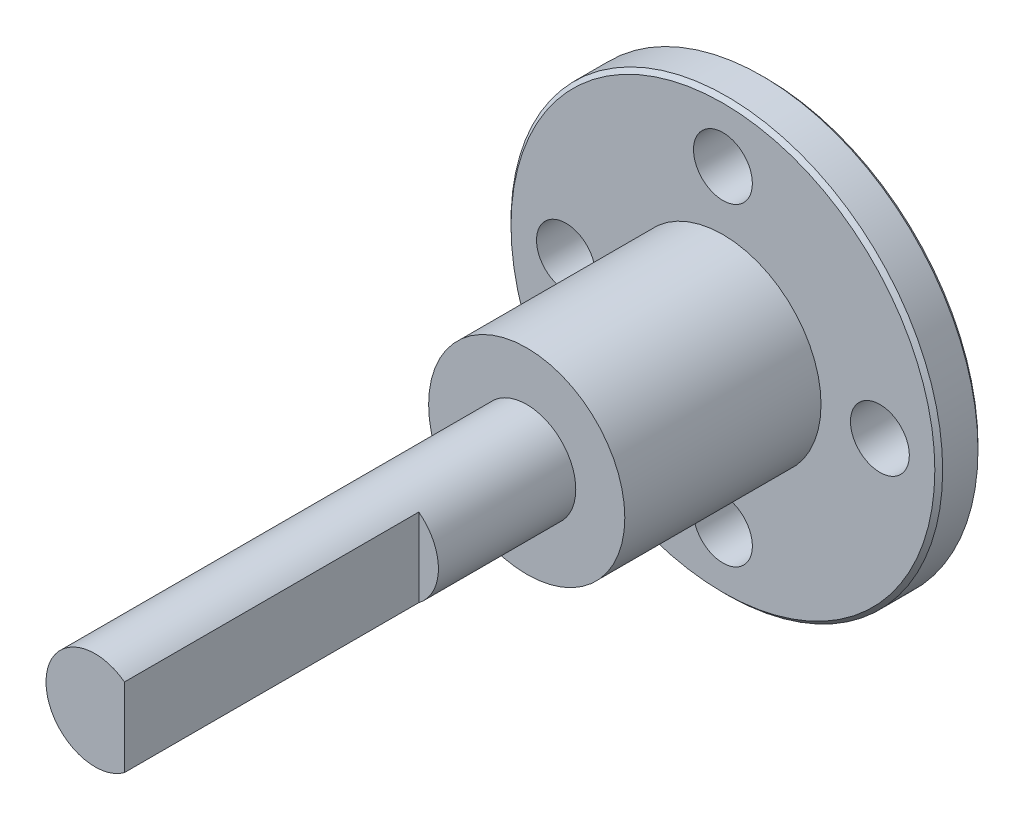
from build123d import *

# Parameters (mm, degrees)
SKETCH_1_R               = 11
EXTRUDE_1_DEPTH          = 2.2
SKETCH_2_R               = 5
EXTRUDE_2_DEPTH          = 10
F_3_0MM_1_D              = 3
PATTERN_CIRCULAR_1_COUNT = 4
CHAMFER_3_SIZE           = 0.2
SKETCH_12_R              = 2.5
EXTRUDE_1789_DEPTH       = 32
CUT_EXTRUDE_START        = -15
CUT_EXTRUDE_1_DEPTH      = 15


with BuildPart() as part:
    # 草图1 → 凸台-拉伸1 (new body)
    with BuildSketch(Plane.XY):
        Circle(SKETCH_1_R)
    extrude(amount=EXTRUDE_1_DEPTH)

    # 草图2 → 凸台-拉伸2 (add)
    with BuildSketch(Plane.XY.offset(2.2)):
        Circle(SKETCH_2_R)
    extrude(amount=EXTRUDE_2_DEPTH)

    # Ø3.0mm 暗销孔1 (through all)
    with Locations(Plane.XY.offset(2.2)):
        with Locations((0, 8)):
            f_3_0mm_1 = Hole(F_3_0MM_1_D / 2)

    # 阵列(圆周)1: Ø3.0mm 暗销孔1 ×4 about axis
    pattern_circular_1_axis = Axis((0, 0, 2.2), (0, 0, -1))
    for i in range(1, PATTERN_CIRCULAR_1_COUNT):
        add(f_3_0mm_1.rotate(pattern_circular_1_axis, i * 360 / PATTERN_CIRCULAR_1_COUNT), mode=Mode.SUBTRACT)

    # 倒角3
    chamfer_3_edges = [part.edges().sort_by_distance(p)[0] for p in [
        (-11, 0, 0),
        (-11, 0, 2.2),
    ]]
    chamfer(chamfer_3_edges, length=CHAMFER_3_SIZE)

    # 草图12 → Extrude 1789 (add)
    with BuildSketch(Plane.XY.offset(2.2)):
        Circle(SKETCH_12_R)
    extrude(amount=EXTRUDE_1789_DEPTH)

    # 草图13 → 切除-拉伸1 (cut)
    with BuildSketch(Plane.XY.offset(34.2).offset(CUT_EXTRUDE_START)):
        with BuildLine():
            Line((1.5, 2), (1.5, -2))
            ThreePointArc((1.5, -2), (2.5, 0), (1.5, 2))
        make_face()
    extrude(amount=CUT_EXTRUDE_1_DEPTH, mode=Mode.SUBTRACT)


solid = part.part
